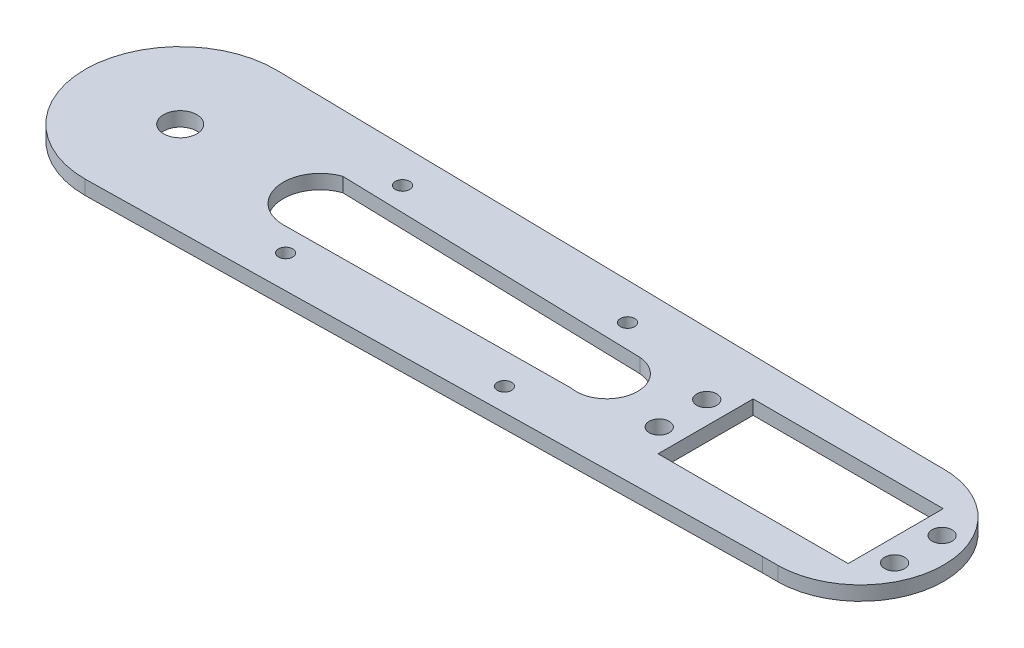
from build123d import *

# Parameters (mm, degrees)
BOSS_EXTRUDE1_DEPTH = 3
SKETCH2_R           = 3.5
SKETCH2_R_2         = 1
SKETCH2_W           = 22.5
SKETCH2_H           = 12
CUT_EXTRUDE1_DEPTH  = 159.793104384
CUT_EXTRUDE3_DEPTH  = 159.793104384
SKETCH9_R           = 4.496455738
CUT_EXTRUDE7_DEPTH  = 10
SKETCH10_R          = 1.5
CUT_EXTRUDE8_DEPTH  = 10
SKETCH11_R          = 2.1
SKETCH11_W          = 40
SKETCH11_H          = 20
CUT_EXTRUDE9_DEPTH  = 10
SKETCH12_R          = 2.1
BOSS_EXTRUDE3_DEPTH = 3


with BuildPart() as part:
    # Sketch1 → Boss-Extrude1 (new body)
    with BuildSketch(Plane(origin=(0, 0, 0), x_dir=(1, 0, 0), z_dir=(0, 1, 0))):
        with BuildLine():
            Line((140.3125, 17.497209599), (0.357142857, 19.99681097))
            ThreePointArc((0.357142857, 19.99681097), (-19.999202727, 0.178578547), (0, -20))
            Line((0, -20), (140, -17.5))
            ThreePointArc((140, -17.5), (157.499302386, -0.156256229), (140.3125, 17.497209599))
        make_face()
    extrude(amount=BOSS_EXTRUDE1_DEPTH)

    # Sketch2 → Cut-Extrude1 (cut, through all)
    # profile 1 of 4: a face of its own
    with BuildSketch(Plane(origin=(0, 3, 0), x_dir=(1, 0, 0), z_dir=(0, 1, 0))):
        Circle(SKETCH2_R)
    # profile 2 of 4: a face of its own
    with BuildSketch(Plane(origin=(0, 3, 0), x_dir=(1, 0, 0), z_dir=(0, 1, 0))):
        with Locations((148.6, 0)):
            Circle(SKETCH2_R_2)
    # profile 3 of 4: a face of its own
    with BuildSketch(Plane(origin=(0, 3, 0), x_dir=(1, 0, 0), z_dir=(0, 1, 0))):
        with Locations((120.9, 0)):
            Circle(SKETCH2_R_2)
    # profile 4 of 4: a face of its own
    with BuildSketch(Plane(origin=(0, 3, 0), x_dir=(1, 0, 0), z_dir=(0, 1, 0))):
        with Locations((134.75, 0)):
            Rectangle(SKETCH2_W, SKETCH2_H)
        with Locations((140, 0)):
            Circle(SKETCH2_R, mode=Mode.SUBTRACT)
    extrude(amount=-CUT_EXTRUDE1_DEPTH, mode=Mode.SUBTRACT)


with BuildPart() as cut_extrude1_piece_1:
    # of the separate pieces the step leaves, piece 1, a body of its own (cut_extrude1_pieces)
    add(part.part.solids().sort_by_distance((140, 0, 17.5))[0])

    # Sketch4 → Cut-Extrude3 (cut, through all)
    with BuildSketch(Plane(origin=(0, 3, 0), x_dir=(1, 0, 0), z_dir=(0, 1, 0))):
        with BuildLine():
            ThreePointArc((89.157599804, -6.948542362), (96.748814448, -1.43935748), (90.892175895, 5.887131633))
            Line((90.892175895, 5.887131633), (26.584417602, 7.617364237))
            ThreePointArc((26.584417602, 7.617364237), (21.507754679, -1.014759032), (29.157599804, -7.477415462))
            Line((29.157599804, -7.477415462), (89.157599804, -6.948542362))
        make_face()
    extrude(amount=-CUT_EXTRUDE3_DEPTH, mode=Mode.SUBTRACT)

    # Sketch10 → Cut-Extrude8 (cut)
    with BuildSketch(Plane(origin=(0, 3, 0), x_dir=(1, 0, 0), z_dir=(0, 1, 0))):
        with Locations((34.541656008, 12.231474735)):
            Circle(SKETCH10_R)
        with Locations((34.541656008, -12.373276524)):
            Circle(SKETCH10_R)
        with Locations((81.871511394, -13.646710106)):
            Circle(SKETCH10_R)
        with Locations((83.194560065, 10.922443863)):
            Circle(SKETCH10_R)
    extrude(amount=-CUT_EXTRUDE8_DEPTH, mode=Mode.SUBTRACT)

    # Sketch11 → Cut-Extrude9 (cut)
    with BuildSketch(Plane(origin=(0, 3, 0), x_dir=(1, 0, 0), z_dir=(0, 1, 0))):
        with Locations((155.08, 5.221934973)):
            Circle(SKETCH11_R)
        with Locations((155.08, -4.778065027)):
            Circle(SKETCH11_R)
        with Locations((105.56, -4.778065027)):
            Circle(SKETCH11_R)
        with Locations((105.56, 5.221934973)):
            Circle(SKETCH11_R)
        with Locations((130.32, 0.221934973)):
            Rectangle(SKETCH11_W, SKETCH11_H)
    extrude(amount=-CUT_EXTRUDE9_DEPTH, mode=Mode.SUBTRACT)

    # Sketch12 → Boss-Extrude3 (add)
    with BuildSketch(Plane(origin=(0, 3, 0), x_dir=(1, 0, 0), z_dir=(0, 1, 0))):
        with BuildLine():
            Line((142.86969749, 17.497209599), (140.3125, 17.497209599))
            ThreePointArc((140.3125, 17.497209599), (145.583961187, 16.585215629), (150.33358345, 14.123280535))
            Line((150.33358345, 14.123280535), (150.33358345, -14.123280535))
            ThreePointArc((150.33358345, -14.123280535), (145.435650404, -16.634413265), (140, -17.5))
            Line((140, -17.5), (143.301107477, -17.5))
            ThreePointArc((143.301107477, -17.5), (160.632042581, 0.214901924), (142.86969749, 17.497209599))
        make_face()
        with Locations((155.08, -4.778065027)):
            Circle(SKETCH12_R, mode=Mode.SUBTRACT)
        with Locations((155.08, 5.221934973)):
            Circle(SKETCH12_R, mode=Mode.SUBTRACT)
    extrude(amount=-BOSS_EXTRUDE3_DEPTH)


with BuildPart() as cut_extrude1_piece_2:
    # of the separate pieces the step leaves, piece 2, a body of its own (cut_extrude1_pieces)
    add(part.part.solids().sort_by_distance((143.5, 0, 0))[0])

    # Sketch9 → Cut-Extrude7 (cut)
    with BuildSketch(Plane(origin=(0, 3, 0), x_dir=(1, 0, 0), z_dir=(0, 1, 0))):
        with Locations((140, 0)):
            Circle(SKETCH9_R)
    extrude(amount=-CUT_EXTRUDE7_DEPTH, mode=Mode.SUBTRACT)


solid = cut_extrude1_piece_1.part
